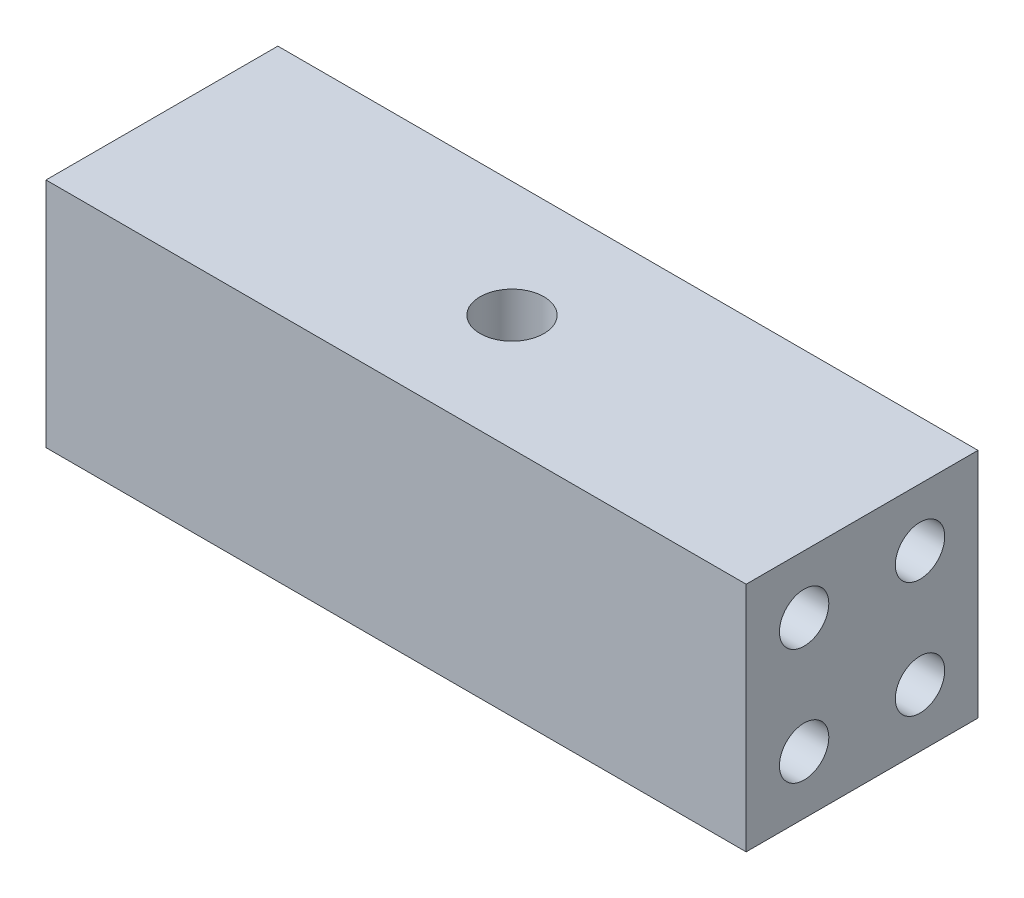
from build123d import *

# Parameters (mm, degrees)
SKETCH1_W                   = 76.708
SKETCH1_H                   = 25.4
BOSS_EXTRUDE1_DEPTH         = 25.4
F_1_4_28_TAPPED_HOLE1_D     = 5.4102
F_1_4_28_TAPPED_HOLE1_DEPTH = 9.144
F_1_4_28_TAPPED_HOLE1_TIP   = 1.625388061
F_1_4_28_TAPPED_HOLE2_D     = 5.4102
F_1_4_28_TAPPED_HOLE2_DEPTH = 9.144
F_1_4_28_TAPPED_HOLE2_TIP   = 1.625388061
F_6_0MM_DOWEL_HOLE1_D       = 7


with BuildPart() as part:
    # Sketch1 → Boss-Extrude1 (new body)
    with BuildSketch(Plane(origin=(0, 0, 0), x_dir=(1, 0, 0), z_dir=(0, 1, 0))):
        with Locations((38.354, 12.7)):
            Rectangle(SKETCH1_W, SKETCH1_H)
    extrude(amount=BOSS_EXTRUDE1_DEPTH)

    # 1/4-28 Tapped Hole1
    with Locations(Plane(origin=(76.708, 0, 0), x_dir=(0, 0, -1), z_dir=(1, 0, 0))):
        with Locations((6.35, 19.05), (19.05, 19.05), (19.05, 6.35), (6.35, 6.35)):
            Hole(F_1_4_28_TAPPED_HOLE1_D / 2, depth=F_1_4_28_TAPPED_HOLE1_DEPTH)
            with Locations((0, 0, -(F_1_4_28_TAPPED_HOLE1_DEPTH + F_1_4_28_TAPPED_HOLE1_TIP / 2))):  # 118° drill point
                Cone(0, F_1_4_28_TAPPED_HOLE1_D / 2, F_1_4_28_TAPPED_HOLE1_TIP, mode=Mode.SUBTRACT)

    # 1/4-28 Tapped Hole2
    with Locations(Plane.ZY):
        with Locations((-19.05, 19.05), (-6.35, 19.05), (-6.35, 6.35), (-19.05, 6.35)):
            Hole(F_1_4_28_TAPPED_HOLE2_D / 2, depth=F_1_4_28_TAPPED_HOLE2_DEPTH)
            with Locations((0, 0, -(F_1_4_28_TAPPED_HOLE2_DEPTH + F_1_4_28_TAPPED_HOLE2_TIP / 2))):  # 118° drill point
                Cone(0, F_1_4_28_TAPPED_HOLE2_D / 2, F_1_4_28_TAPPED_HOLE2_TIP, mode=Mode.SUBTRACT)

    # Ø6.0mm Dowel Hole1 (through all)
    with Locations(Plane(origin=(0, 25.4, 0), x_dir=(1, 0, 0), z_dir=(0, 1, 0))):
        with Locations((38.354, 12.7)):
            Hole(F_6_0MM_DOWEL_HOLE1_D / 2)


solid = part.part
